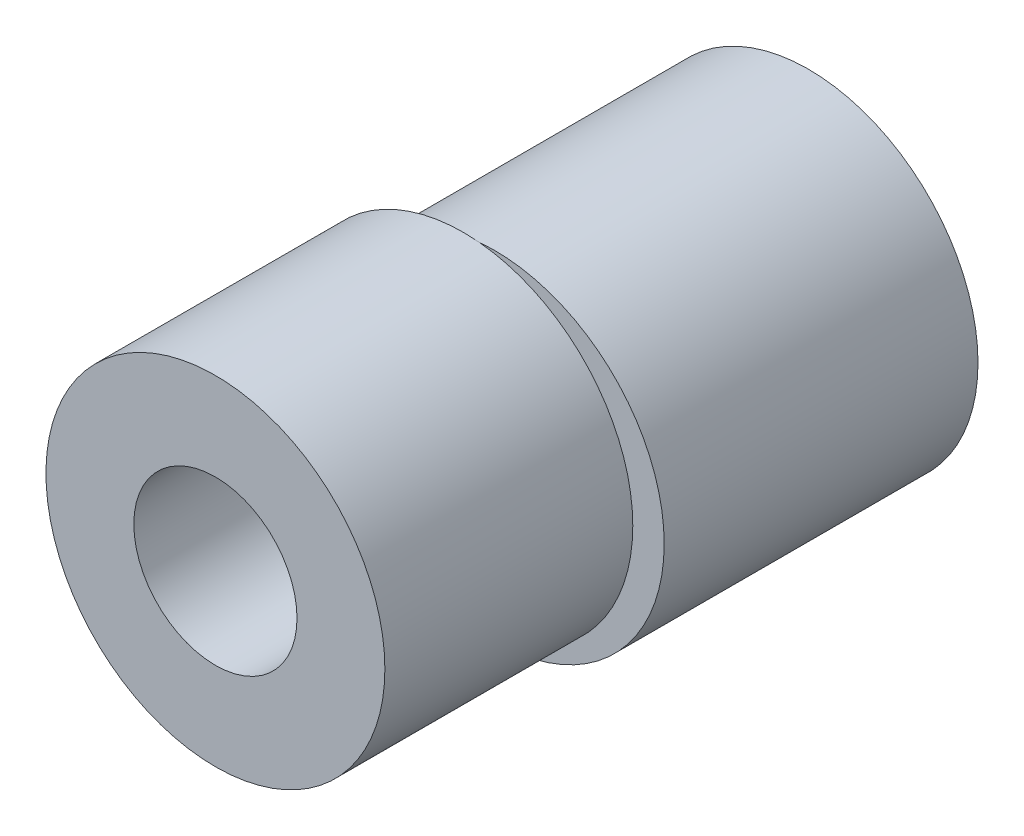
from build123d import *

# Parameters (mm, degrees)
SKIZZE1_R                       = 5.4
AUFSATZ_LINEAR_AUSTRAGEN1_DEPTH = 10
SKIZZE2_R                       = 5.4
AUFSATZ_LINEAR_AUSTRAGEN2_DEPTH = 7.9
SCHNITT_LINEAR_AUSTRAGEN1_REACH = 21.762
SKIZZE3_R                       = 2.6
SKIZZE5_W                       = 0.5
SKIZZE5_H                       = 3.980603343
AUFSATZ_LINEAR_AUSTRAGEN3_DEPTH = 7.9


with BuildPart() as part:
    # Skizze1 → Aufsatz-Linear austragen1 (new body)
    with BuildSketch(Plane.XY):
        Circle(SKIZZE1_R)
    extrude(amount=AUFSATZ_LINEAR_AUSTRAGEN1_DEPTH)

    # Skizze2 → Aufsatz-Linear austragen2 (add)
    with BuildSketch(Plane.XY.offset(10)):
        with Locations((-1, 0)):
            Circle(SKIZZE2_R)
    extrude(amount=AUFSATZ_LINEAR_AUSTRAGEN2_DEPTH)

    # Skizze3 → Schnitt-Linear austragen1 (cut, up to next)
    with BuildSketch(Plane.XY.offset(17.9), mode=Mode.PRIVATE) as schnitt_linear_austragen1_sk1:
        with Locations((-1, 0)):
            Circle(SKIZZE3_R)
    schnitt_linear_austragen1_tool1 = extrude(schnitt_linear_austragen1_sk1.sketch, amount=-SCHNITT_LINEAR_AUSTRAGEN1_REACH, mode=Mode.PRIVATE) & part.part
    add(schnitt_linear_austragen1_tool1.solids().sort_by_distance((-1, 0, 17.9))[0], mode=Mode.SUBTRACT)

    # Skizze5 → Aufsatz-Linear austragen3 (add)
    with BuildSketch(Plane(origin=(0, 0, 0), x_dir=(-1, 0, 0), z_dir=(0, 0, -1))):
        with Locations((3.325, -0.423657169)):
            Rectangle(SKIZZE5_W, SKIZZE5_H)
    extrude(amount=-AUFSATZ_LINEAR_AUSTRAGEN3_DEPTH)


solid = part.part
